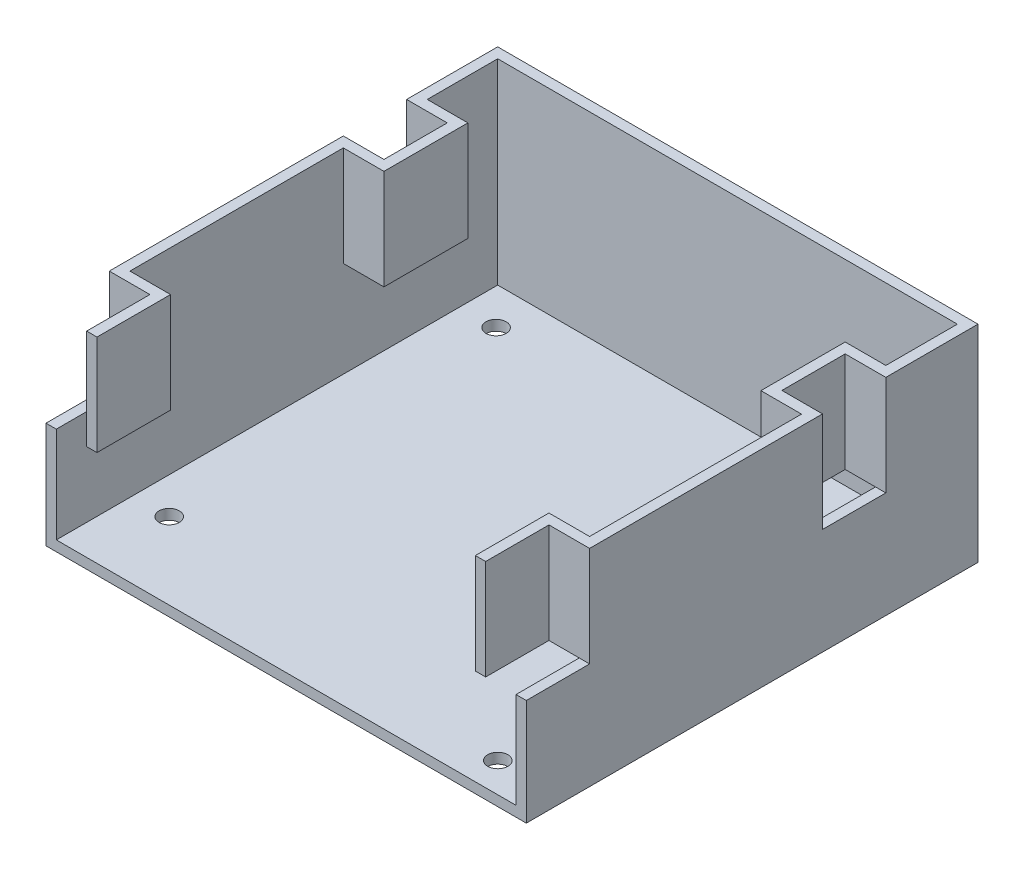
from build123d import *

# Parameters (mm, degrees)
SKETCH1_W           = 89.12
SKETCH1_H           = 85.57
BOSS_EXTRUDE1_DEPTH = 2
SKETCH3_W           = 2
SKETCH3_H           = 30
BOSS_EXTRUDE2_DEPTH = 85.57
SKETCH4_W           = 2
SKETCH4_H           = 30
BOSS_EXTRUDE3_DEPTH = 85.57
SKETCH5_W           = 93.12
SKETCH5_H           = 2
BOSS_EXTRUDE4_DEPTH = 30
SKETCH6_R           = 1.96
CUT_EXTRUDE2_DEPTH  = 30
SKETCH7_R           = 1.96
CUT_EXTRUDE3_DEPTH  = 30
SKETCH8_R           = 1.96
CUT_EXTRUDE4_DEPTH  = 30
SKETCH9_R           = 1.96
CUT_EXTRUDE5_DEPTH  = 30
BOSS_EXTRUDE5_DEPTH = 9.4
SKETCH12_W          = 2
SKETCH12_H          = 12.27
CUT_EXTRUDE6_DEPTH  = 9.4
BOSS_EXTRUDE6_DEPTH = 9.4
SKETCH14_W          = 2
SKETCH14_H          = 12.27
CUT_EXTRUDE7_DEPTH  = 9.4
BOSS_EXTRUDE7_DEPTH = 9.4
SKETCH16_W          = 2
SKETCH16_H          = 12.27
CUT_EXTRUDE8_DEPTH  = 9.4
BOSS_EXTRUDE8_DEPTH = 9.4
SKETCH18_W          = 2
SKETCH18_H          = 12.27
CUT_EXTRUDE9_DEPTH  = 9.4
BOSS_EXTRUDE9_DEPTH = 10


with BuildPart() as part:
    # Sketch1 → Boss-Extrude1 (new body)
    with BuildSketch(Plane(origin=(0, 0, 0), x_dir=(1, 0, 0), z_dir=(0, 1, 0))):
        with Locations((44.56, 42.785)):
            Rectangle(SKETCH1_W, SKETCH1_H)
    extrude(amount=BOSS_EXTRUDE1_DEPTH)

    # Sketch3 → Boss-Extrude2 (add)
    with BuildSketch(Plane.XY):
        with Locations((-1, 15)):
            Rectangle(SKETCH3_W, SKETCH3_H)
    extrude(amount=-BOSS_EXTRUDE2_DEPTH)

    # Sketch4 → Boss-Extrude3 (add)
    with BuildSketch(Plane.XY):
        with Locations((90.12, 15)):
            Rectangle(SKETCH4_W, SKETCH4_H)
    extrude(amount=-BOSS_EXTRUDE3_DEPTH)

    # Sketch5 → Boss-Extrude4 (add)
    with BuildSketch(Plane(origin=(0, 0, 0), x_dir=(1, 0, 0), z_dir=(0, 1, 0))):
        with Locations((44.56, 86.57)):
            Rectangle(SKETCH5_W, SKETCH5_H)
    extrude(amount=BOSS_EXTRUDE4_DEPTH)

    # Sketch6 → Cut-Extrude2 (cut)
    with BuildSketch(Plane(origin=(0, 0, 0), x_dir=(1, 0, 0), z_dir=(0, 1, 0))):
        with Locations((79.835, 5.755)):
            Circle(SKETCH6_R)
    extrude(amount=CUT_EXTRUDE2_DEPTH, mode=Mode.SUBTRACT)

    # Sketch7 → Cut-Extrude3 (cut)
    with BuildSketch(Plane(origin=(0, 2, 0), x_dir=(1, 0, 0), z_dir=(0, 1, 0))):
        with Locations((82.285, 76.225)):
            Circle(SKETCH7_R)
    extrude(amount=-CUT_EXTRUDE3_DEPTH, mode=Mode.SUBTRACT)

    # Sketch8 → Cut-Extrude4 (cut)
    with BuildSketch(Plane(origin=(0, 0, 0), x_dir=(1, 0, 0), z_dir=(0, 1, 0))):
        with Locations((6.985, 78.28)):
            Circle(SKETCH8_R)
    extrude(amount=CUT_EXTRUDE4_DEPTH, mode=Mode.SUBTRACT)

    # Sketch9 → Cut-Extrude5 (cut)
    with BuildSketch(Plane(origin=(0, 2, 0), x_dir=(1, 0, 0), z_dir=(0, 1, 0))):
        with Locations((7.035, 14.85)):
            Circle(SKETCH9_R)
    extrude(amount=-CUT_EXTRUDE5_DEPTH, mode=Mode.SUBTRACT)

    # Sketch11 → Boss-Extrude5 (add)
    with BuildSketch(Plane(origin=(0, 30, 0), x_dir=(1, 0, 0), z_dir=(0, 1, 0))):
        Polygon((81.24, 0), (83.24, 0), (83.24, 12.27), (89.12, 12.27), (89.12, 14.27), (81.24, 14.27), align=None)
    extrude(amount=-BOSS_EXTRUDE5_DEPTH)

    # Sketch12 → Cut-Extrude6 (cut)
    with BuildSketch(Plane(origin=(0, 30, 0), x_dir=(1, 0, 0), z_dir=(0, 1, 0))):
        with Locations((90.12, 6.135)):
            Rectangle(SKETCH12_W, SKETCH12_H)
    extrude(amount=-CUT_EXTRUDE6_DEPTH, mode=Mode.SUBTRACT)

    # Sketch13 → Boss-Extrude6 (add)
    with BuildSketch(Plane(origin=(0, 30, 0), x_dir=(1, 0, 0), z_dir=(0, 1, 0))):
        Polygon((89.12, 55.359786784), (89.12, 57.43), (83.24, 57.43), (83.24, 69.7), (89.12, 69.7), (89.12, 71.7), (81.24, 71.7), (81.24, 55.359786784), align=None)
    extrude(amount=-BOSS_EXTRUDE6_DEPTH)

    # Sketch14 → Cut-Extrude7 (cut)
    with BuildSketch(Plane(origin=(0, 30, 0), x_dir=(1, 0, 0), z_dir=(0, 1, 0))):
        with Locations((90.12, 63.565)):
            Rectangle(SKETCH14_W, SKETCH14_H)
    extrude(amount=-CUT_EXTRUDE7_DEPTH, mode=Mode.SUBTRACT)

    # Sketch15 → Boss-Extrude7 (add)
    with BuildSketch(Plane(origin=(0, 30, 0), x_dir=(1, 0, 0), z_dir=(0, 1, 0))):
        Polygon((5.88, 57.64), (0, 57.64), (0, 55.64), (7.88, 55.64), (7.88, 71.91), (0, 71.91), (0, 69.91), (5.88, 69.91), align=None)
    extrude(amount=-BOSS_EXTRUDE7_DEPTH)

    # Sketch16 → Cut-Extrude8 (cut)
    with BuildSketch(Plane(origin=(0, 30, 0), x_dir=(1, 0, 0), z_dir=(0, 1, 0))):
        with Locations((-1, 63.775)):
            Rectangle(SKETCH16_W, SKETCH16_H)
    extrude(amount=-CUT_EXTRUDE8_DEPTH, mode=Mode.SUBTRACT)

    # Sketch17 → Boss-Extrude8 (add)
    with BuildSketch(Plane(origin=(0, 30, 0), x_dir=(1, 0, 0), z_dir=(0, 1, 0))):
        Polygon((5.88, 12.27), (5.88, 0), (7.88, 0), (7.88, 14.27), (0, 14.27), (0, 12.27), align=None)
    extrude(amount=-BOSS_EXTRUDE8_DEPTH)

    # Sketch18 → Cut-Extrude9 (cut)
    with BuildSketch(Plane(origin=(0, 30, 0), x_dir=(1, 0, 0), z_dir=(0, 1, 0))):
        with Locations((-1, 6.135)):
            Rectangle(SKETCH18_W, SKETCH18_H)
    extrude(amount=-CUT_EXTRUDE9_DEPTH, mode=Mode.SUBTRACT)

    # Sketch19 → Boss-Extrude9 (add)
    with BuildSketch(Plane(origin=(0, 30, 0), x_dir=(1, 0, 0), z_dir=(0, 1, 0))):
        Polygon((83.24, 0), (81.24, 0), (81.24, 14.27), (89.12, 14.27), (89.12, 55.359786784), (81.24, 55.359786784), (81.24, 71.7), (89.12, 71.7), (89.12, 85.57), (0, 85.57), (0, 71.91), (7.88, 71.91), (7.88, 55.64), (0, 55.64), (0, 14.27), (7.88, 14.27), (7.88, 0), (5.88, 0), (5.88, 12.27), (-2, 12.27), (-2, 57.64), (5.88, 57.64), (5.88, 69.91), (-2, 69.91), (-2, 87.57), (91.12, 87.57), (91.12, 69.7), (83.24, 69.7), (83.24, 57.43), (91.12, 57.43), (91.12, 12.27), (83.24, 12.27), align=None)
    extrude(amount=BOSS_EXTRUDE9_DEPTH)


solid = part.part
